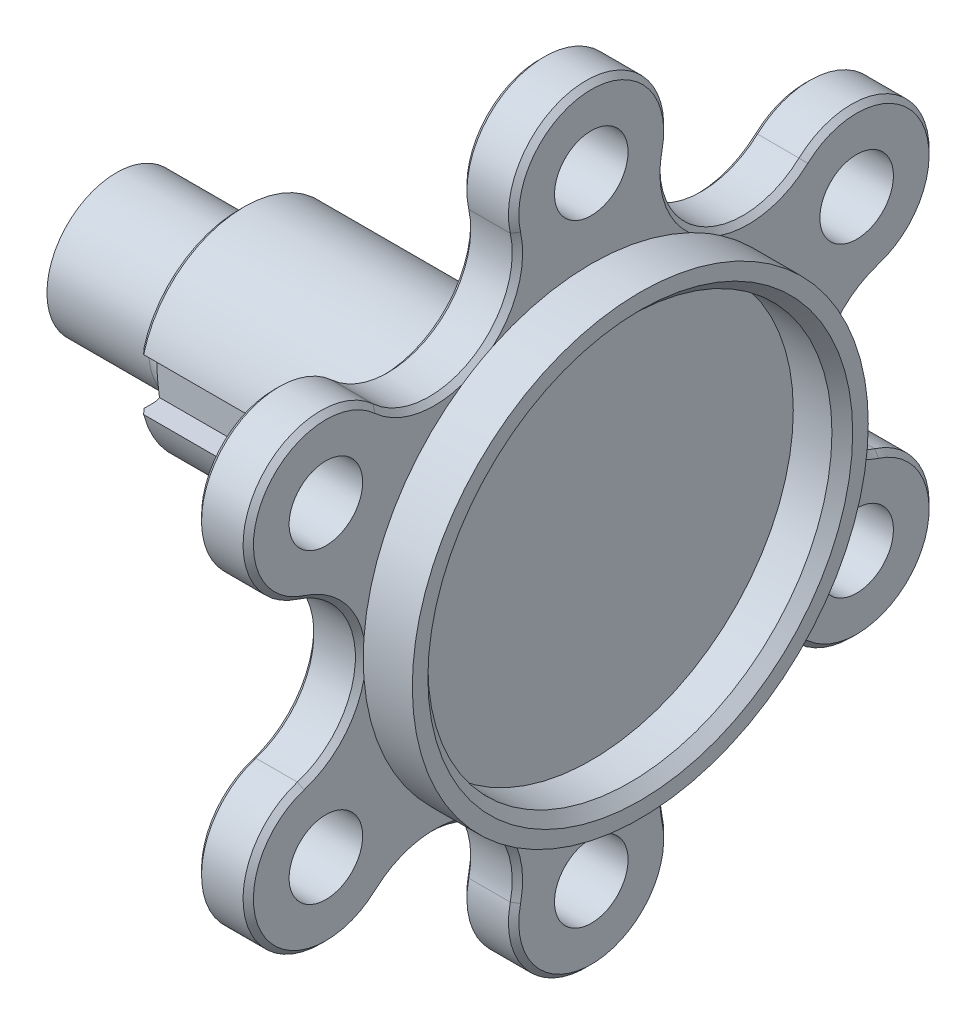
from build123d import *

# Parameters (mm, degrees)
SKETCH1_R              = 47
BASE_EXTRUDE_DEPTH     = 6.35
M8_CLEARANCE_HOLES_D   = 9
CIRPATTERN_COUNT       = 6
CUT_EXTRUDE_DEPTH      = 67.770670957
CUT_EXTRUDE_DEPTH_BACK = 67.770670957
CHAMFER1_SIZE          = 0.635
SKETCH8_R              = 12.7
SHAFT_EXTRUDE_DEPTH    = 51.76000062
CHAMFER3_SIZE          = 0.635
SHAFT_CHAMFER_SIZE     = 1
SKETCH30_R             = 27.89936
SKETCH30_R_2           = 24.72436
LIP_EXTRUDE_DEPTH      = 5.99948
LIP_CHAMFER_SIZE       = 1.27
CUT_EXTRUDE1_START     = -15
SKETCH45_R             = 12.7
SKETCH45_R_2           = 8.5
CUT_EXTRUDE1_DEPTH     = 15
CHAMFER4_SIZE          = 0.635
FILLET2_R              = 2.54
CUT_EXTRUDE3_DEPTH     = 3.175
FILLET3_R              = 2.54


with BuildPart() as part:
    # Sketch1 → Base-Extrude (new body)
    with BuildSketch(Plane(origin=(0, 0, 0), x_dir=(0, 0, -1), z_dir=(1, 0, 0))):
        Circle(SKETCH1_R)
    extrude(amount=-BASE_EXTRUDE_DEPTH)

    # M8 Clearance Holes (through all)
    with Locations(Plane(origin=(0, 0, 0), x_dir=(0, 0, -1), z_dir=(1, 0, 0))):
        with Locations((0, -37.5)):
            m8_clearance_holes = Hole(M8_CLEARANCE_HOLES_D / 2)

    # CirPattern: M8 Clearance Holes ×6 about axis
    cirpattern_axis = Axis((0, 0, 0), (1, 0, 0))
    for i in range(1, CIRPATTERN_COUNT):
        add(m8_clearance_holes.rotate(cirpattern_axis, i * 360 / CIRPATTERN_COUNT), mode=Mode.SUBTRACT)

    # Sketch19 → Cut-Extrude (cut, two sides: drawn at the far end of the back side and taken through both)
    with BuildSketch(Plane(origin=(0, 0, 0), x_dir=(0, 0, -1), z_dir=(1, 0, 0)).offset(-CUT_EXTRUDE_DEPTH_BACK)):
        with BuildLine():
            ThreePointArc((9.274838239, 35.443941724), (14.114033661, 24.446223401), (26.057934823, 25.754216393))
            ThreePointArc((26.057934823, 25.754216393), (33.921184851, 28.139425108), (40.703194264, 23.499999504))
            ThreePointArc((40.703194264, 23.499999504), (23.500000227, 40.703193847), (-4.7e-08, 47))
            ThreePointArc((-4.7e-08, 47), (7.40886473, 43.446320157), (9.274838239, 35.443941724))
        make_face()
        with BuildLine():
            ThreePointArc((-26.057934823, 25.754216393), (-14.114033661, 24.446223401), (-9.274838239, 35.443941724))
            ThreePointArc((-9.274838239, 35.443941724), (-7.40886476, 43.44632012), (-4.7e-08, 47))
            ThreePointArc((-4.7e-08, 47), (-23.500000787, 40.703193523), (-40.703194863, 23.499998466))
            ThreePointArc((-40.703194863, 23.499998466), (-33.921185443, 28.139425017), (-26.057934823, 25.754216393))
        make_face()
        with BuildLine():
            ThreePointArc((40.703193464, -23.50000089), (47, -8e-07), (40.703194264, 23.499999504))
            ThreePointArc((40.703194264, 23.499999504), (41.33004921, 15.30689472), (35.332773062, 9.689725331))
            ThreePointArc((35.332773062, 9.689725331), (28.228067323, 0), (35.332773062, -9.689725331))
            ThreePointArc((35.332773062, -9.689725331), (41.330049499, -15.306895465), (40.703193464, -23.50000089))
        make_face()
        with BuildLine():
            ThreePointArc((-35.332773062, 9.689725331), (-41.330048992, 15.306894161), (-40.703194863, 23.499998466))
            ThreePointArc((-40.703194863, 23.499998466), (-47, -6.9e-08), (-40.703194794, -23.499998586))
            ThreePointArc((-40.703194794, -23.499998586), (-41.330049018, -15.306894226), (-35.332773062, -9.689725331))
            ThreePointArc((-35.332773062, -9.689725331), (-28.228067323, 0), (-35.332773062, 9.689725331))
        make_face()
        with BuildLine():
            ThreePointArc((-26.057934823, -25.754216393), (-33.921185375, -28.139425028), (-40.703194794, -23.499998586))
            ThreePointArc((-40.703194794, -23.499998586), (-23.500000688, -40.703193581), (4.4e-08, -47))
            ThreePointArc((4.4e-08, -47), (-7.408864732, -43.446320155), (-9.274838239, -35.443941724))
            ThreePointArc((-9.274838239, -35.443941724), (-14.114033661, -24.446223401), (-26.057934823, -25.754216393))
        make_face()
        with BuildLine():
            ThreePointArc((4.4e-08, -47), (23.499999574, -40.703194224), (40.703193464, -23.50000089))
            ThreePointArc((40.703193464, -23.50000089), (33.92118406, -28.13942523), (26.057934823, -25.754216393))
            ThreePointArc((26.057934823, -25.754216393), (14.114033661, -24.446223401), (9.274838239, -35.443941724))
            ThreePointArc((9.274838239, -35.443941724), (7.408864759, -43.446320121), (4.4e-08, -47))
        make_face()
    extrude(amount=CUT_EXTRUDE_DEPTH + CUT_EXTRUDE_DEPTH_BACK, mode=Mode.SUBTRACT)

    # Chamfer1
    chamfer1_edges = [part.edges().sort_by_distance(p)[0] for p in [
        (-6.35, -24.446223401, 14.114033661),
        (-6.35, 24.446223401, -14.114033661),
        (-6.35, 24.446223401, 14.114033661),
        (-6.35, 23.5, 40.703193978),
        (-6.35, 47, 0),
        (-6.35, -24.446223401, -14.114033661),
        (-6.35, -23.5, -40.703193978),
        (-6.35, -47, 0),
        (-6.35, 0, 28.228067323),
        (-6.35, -23.5, 40.703193978),
        (-6.35, 0, -28.228067323),
        (-6.35, 23.5, -40.703193978),
    ]]
    chamfer(chamfer1_edges, length=CHAMFER1_SIZE)

    # Sketch8 → Shaft-Extrude (add)
    with BuildSketch(Plane.ZY.offset(6.35)):
        with Locations(Location((0, 0, 0), (0, 0, 180))):
            Circle(SKETCH8_R)
    extrude(amount=SHAFT_EXTRUDE_DEPTH)

    # Chamfer3
    chamfer3_edges = [part.edges().sort_by_distance(p)[0] for p in [
        (0, 24.446223401, -14.114033661),
        (0, -24.446223401, 14.114033661),
        (0, -24.446223401, -14.114033661),
        (0, -47, 0),
        (0, -23.5, -40.703193978),
        (0, 24.446223401, 14.114033661),
        (0, 47, 0),
        (0, 23.5, 40.703193978),
        (0, 0, -28.228067323),
        (0, 23.5, -40.703193978),
        (0, 0, 28.228067323),
        (0, -23.5, 40.703193978),
    ]]
    chamfer(chamfer3_edges, length=CHAMFER3_SIZE)

    # Shaft Chamfer
    shaft_chamfer_edges = [part.edges().sort_by_distance(p)[0] for p in [
        (-58.11000062, 0, 12.7),
    ]]
    chamfer(shaft_chamfer_edges, length=SHAFT_CHAMFER_SIZE)

    # Sketch30 → Lip Extrude (add)
    with BuildSketch(Plane(origin=(0, 0, 0), x_dir=(0, 0, -1), z_dir=(1, 0, 0))):
        with Locations(Location((0, 0, 0), (0, 0, 175.528743947))):
            Circle(SKETCH30_R)
        with Locations(Location((0, 0, 0), (0, 0, 180))):
            Circle(SKETCH30_R_2, mode=Mode.SUBTRACT)
    extrude(amount=LIP_EXTRUDE_DEPTH)

    # Lip Chamfer
    lip_chamfer_edges = [part.edges().sort_by_distance(p)[0] for p in [
        (5.99948, 0, -24.72436),
    ]]
    chamfer(lip_chamfer_edges, length=LIP_CHAMFER_SIZE)

    # Sketch45 → Cut-Extrude1 (cut)
    with BuildSketch(Plane.ZY.offset(58.11000062).offset(CUT_EXTRUDE1_START)):
        with Locations(Location((0, 0, 0), (0, 0, 180))):
            Circle(SKETCH45_R)
        Circle(SKETCH45_R_2, mode=Mode.SUBTRACT)
    extrude(amount=CUT_EXTRUDE1_DEPTH, mode=Mode.SUBTRACT)

    # Chamfer4
    chamfer4_edges = [part.edges().sort_by_distance(p)[0] for p in [
        (-43.11000062, 0, 12.7),
    ]]
    chamfer(chamfer4_edges, length=CHAMFER4_SIZE)

    # Fillet2
    fillet2_edges = [part.edges().sort_by_distance(p)[0] for p in [
        (-6.35, 0, 12.7),
    ]]
    fillet(fillet2_edges, radius=FILLET2_R)

    # Sketch48 → Cut-Extrude3 (cut)
    with BuildSketch(Plane.XY.offset(12.7)):
        with BuildLine():
            ThreePointArc((-19.61500062, 0), (-20.54493659, 2.24506403), (-22.79000062, 3.175))
            Line((-22.79000062, 3.175), (-43.11000062, 3.175))
            Line((-43.11000062, 3.175), (-43.11000062, 0))
            Line((-43.11000062, 0), (-19.61500062, 0))
        make_face()
        with BuildLine():
            ThreePointArc((-22.79000062, -3.175), (-20.54493659, -2.24506403), (-19.61500062, 0))
            Line((-19.61500062, 0), (-43.11000062, 0))
            Line((-43.11000062, 0), (-43.11000062, -3.175))
            Line((-43.11000062, -3.175), (-22.79000062, -3.175))
        make_face()
    extrude(amount=-CUT_EXTRUDE3_DEPTH, mode=Mode.SUBTRACT)

    # Fillet3
    # the kernel refuses this fillet: 2.54 mm, written as the material it adds along each edge
    with BuildSketch(Plane(origin=(-43.11000062, 0, 0), x_dir=(0, 0, 1), z_dir=(0, -1, 0))) as fillet3_piece_1_section:
        with BuildLine():
            CenterArc((8.5 + FILLET3_R, FILLET3_R), FILLET3_R, 180, 90)
            Line((8.5, FILLET3_R), (8.5, 0))
            Line((8.5, 0), (8.5 + FILLET3_R, 0))
        make_face()
    fillet3_piece_1 = revolve(axis=Axis((-43.11000062, 0, 0), (-1, 0, 0)), mode=Mode.PRIVATE)
    fillet3_piece_1 = split(fillet3_piece_1, bisect_by=Plane(origin=(-43.740743276, 3.41e-07, 9.525), z_dir=(0, 0, -1)), keep=Keep.TOP, mode=Mode.PRIVATE)
    add(fillet3_piece_1)
    with BuildSketch(Plane(origin=(-43.11000062, 0, 0), x_dir=(0, 0, 1), z_dir=(0, -1, 0))) as fillet3_piece_2_section:
        with BuildLine():
            CenterArc((8.5 + FILLET3_R, FILLET3_R), FILLET3_R, 180, 90)
            Line((8.5, FILLET3_R), (8.5, 0))
            Line((8.5, 0), (8.5 + FILLET3_R, 0))
        make_face()
    fillet3_piece_2 = revolve(axis=Axis((-43.11000062, 0, 0), (-1, 0, 0)), mode=Mode.PRIVATE)
    fillet3_piece_2 = split(fillet3_piece_2, bisect_by=Plane(origin=(-43.151597018, 3.175, 9.740498965), z_dir=(0, 1, 0)), keep=Keep.TOP, mode=Mode.PRIVATE)
    add(fillet3_piece_2)
    with BuildSketch(Plane(origin=(-43.11000062, 0, 0), x_dir=(0, 0, 1), z_dir=(0, -1, 0))) as fillet3_piece_3_section:
        with BuildLine():
            CenterArc((8.5 + FILLET3_R, FILLET3_R), FILLET3_R, 180, 90)
            Line((8.5, FILLET3_R), (8.5, 0))
            Line((8.5, 0), (8.5 + FILLET3_R, 0))
        make_face()
    fillet3_piece_3 = revolve(axis=Axis((-43.11000062, 0, 0), (-1, 0, 0)), mode=Mode.PRIVATE)
    fillet3_piece_3 = split(fillet3_piece_3, bisect_by=Plane(origin=(-43.151597018, -3.175, 9.740498965), z_dir=(0, -1, 0)), keep=Keep.TOP, mode=Mode.PRIVATE)
    add(fillet3_piece_3)


solid = part.part
